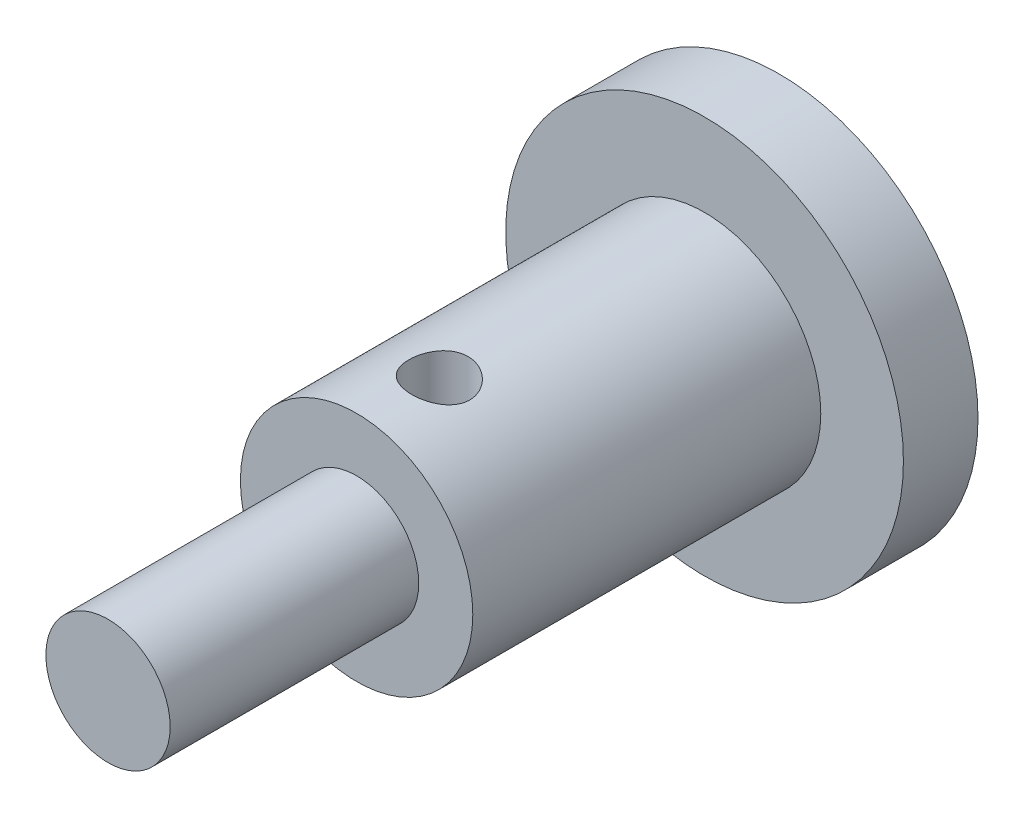
from build123d import *

# Parameters (mm, degrees)
SKETCH1_R           = 8
BOSS_EXTRUDE1_DEPTH = 3
SKETCH2_R           = 4.675
BOSS_EXTRUDE2_DEPTH = 14
SKETCH3_R           = 2.5
BOSS_EXTRUDE3_DEPTH = 10
SKETCH4_R           = 1.225
CUT_EXTRUDE1_DEPTH  = 7.5


with BuildPart() as part:
    # Sketch1 → Boss-Extrude1 (new body)
    with BuildSketch(Plane.XY):
        Circle(SKETCH1_R)
    extrude(amount=BOSS_EXTRUDE1_DEPTH)

    # Sketch2 → Boss-Extrude2 (add)
    with BuildSketch(Plane.XY.offset(3)):
        Circle(SKETCH2_R)
    extrude(amount=BOSS_EXTRUDE2_DEPTH)

    # Sketch3 → Boss-Extrude3 (add)
    with BuildSketch(Plane.XY.offset(17)):
        Circle(SKETCH3_R)
    extrude(amount=BOSS_EXTRUDE3_DEPTH)

    # Sketch4 → Cut-Extrude1 (cut, symmetric)
    with BuildSketch(Plane(origin=(0, 0, 0), x_dir=(1, 0, 0), z_dir=(0, 1, 0))):
        with Locations((0.325, -13.99622717)):
            Circle(SKETCH4_R)
    extrude(amount=CUT_EXTRUDE1_DEPTH, both=True, mode=Mode.SUBTRACT)


solid = part.part
